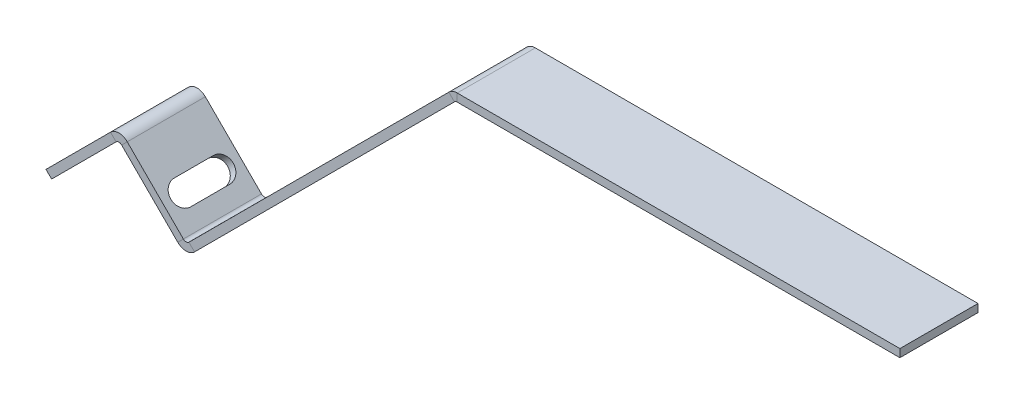
from build123d import *

# Parameters (mm, degrees)
BASE_FLANGE1_DEPTH = 10
CUT_EXTRUDE1_DEPTH = 2.032
CUT_EXTRUDE2_DEPTH = 2.032


# Sheet-metal steps are written as plain solids
with BuildPart() as part:
    # Sketch1 → Base-Flange1 (new, symmetric)
    with BuildSketch(Plane.XY):
        with BuildLine():
            Line((-17.225320151, -6), (-0.707106781, 10.51821337))
            ThreePointArc((-0.707106781, 10.51821337), (0, 10.811106589), (0.707106781, 10.51821337))
            Line((0.707106781, 10.51821337), (15.081372391, -3.856052239))
            ThreePointArc((15.081372391, -3.856052239), (17.225320151, -4.744104479), (19.369267912, -3.856052239))
            Line((19.369267912, -3.856052239), (85.932426933, 62.707106781))
            ThreePointArc((85.932426933, 62.707106781), (86.256850281, 62.923879533), (86.639533714, 63))
            Line((86.639533714, 63), (200, 63))
            Line((200, 63), (200, 65.032))
            Line((200, 65.032), (86.639533714, 65.032))
            ThreePointArc((86.639533714, 65.032), (85.479237547, 64.801202743), (84.495585953, 64.143947761))
            Line((84.495585953, 64.143947761), (17.932426933, -2.41921126))
            ThreePointArc((17.932426933, -2.41921126), (17.225320151, -2.712104479), (16.51821337, -2.41921126))
            Line((16.51821337, -2.41921126), (2.143947761, 11.95505435))
            ThreePointArc((2.143947761, 11.95505435), (0, 12.843106589), (-2.143947761, 11.95505435))
            Line((-2.143947761, 11.95505435), (-18.662161131, -4.563159021))
            Line((-18.662161131, -4.563159021), (-17.225320151, -6))
        make_face()
    extrude(amount=BASE_FLANGE1_DEPTH, both=True)

    # Sketch6 → Cut-Extrude1 (cut)
    with BuildSketch(Plane(origin=(-7.049501055, 7.049501055, 0), x_dir=(0, 0, 1), z_dir=(-0.7071067811865488, 0.7071067811865464, 0))):
        with BuildLine():
            Line((-5, -5), (5, -5))
            ThreePointArc((5, -5), (8, -8), (5, -11))
            Line((5, -11), (-5, -11))
            ThreePointArc((-5, -11), (-8, -8), (-5, -5))
        make_face()
    extrude(amount=-CUT_EXTRUDE1_DEPTH, mode=Mode.SUBTRACT)

    # Sketch9 → Cut-Extrude2 (cut)
    with BuildSketch(Plane(origin=(7.049501055, 7.049501055, 0), x_dir=(0, 0, -1), z_dir=(0.7071067811865488, 0.7071067811865464, 0))):
        with BuildLine():
            Line((-5, -3), (5, -3))
            ThreePointArc((5, -3), (8, -6), (5, -9))
            Line((5, -9), (-5, -9))
            ThreePointArc((-5, -9), (-8, -6), (-5, -3))
        make_face()
    extrude(amount=-CUT_EXTRUDE2_DEPTH, mode=Mode.SUBTRACT)


solid = part.part
